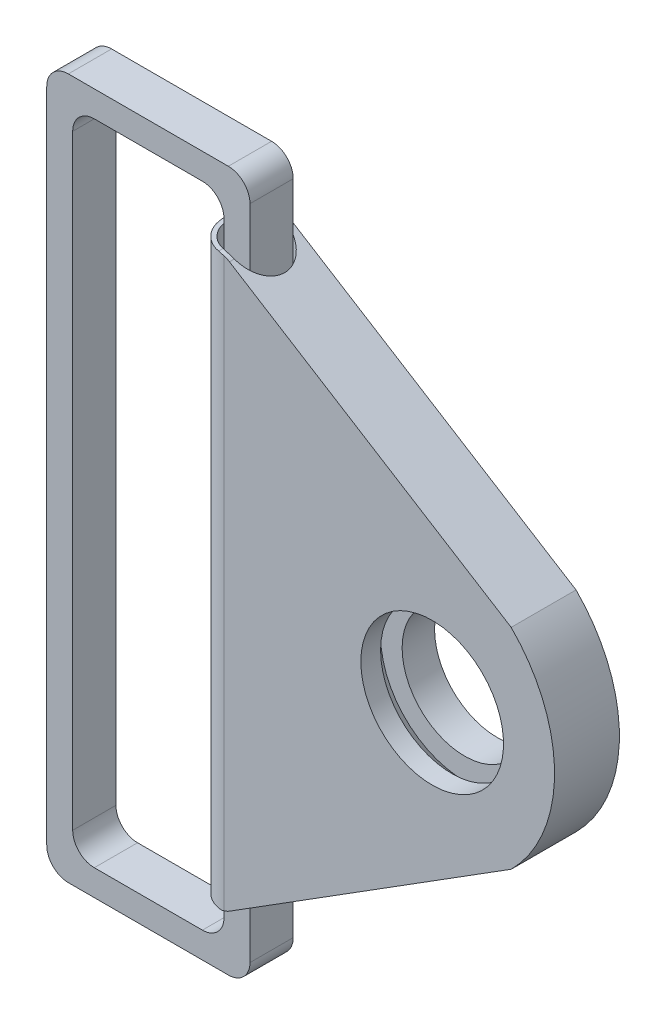
from build123d import *

# Parameters (mm, degrees)
SCHIZZO1_R                               = 2.88998006
ESTRUSIONE_ESTRUSIONE1_DEPTH             = 1.5
ESTRUSIONE_ESTRUSIONE3_REACH             = 22.293
SCHIZZO2_R                               = 1.5
ESTRUSIONE_ESTRUSIONE3_DIRECTION_2_REACH = 22.293
TAGLIO_ESTRUSIONE2_REACH                 = 22.922
SCHIZZO4_R                               = 1.297765186
TAGLIO_ESTRUSIONE2_DIRECTION_2_REACH     = 22.922
TAGLIO_ESTRUSIONE3_DEPTH                 = 21.921930902
TAGLIO_ESTRUSIONE3_DEPTH_BACK            = 21.921930902
RACCORDO3_R                              = 1
RACCORDO4_R                              = 1
SCHIZZO8_W                               = 9.4
SCHIZZO8_H                               = 32.4
SCHIZZO8_W_2                             = 7
SCHIZZO8_H_2                             = 30
ESTRUSIONE_SOTTILE1_DEPTH                = 1
RACCORDO9_R                              = 1
RACCORDO10_R                             = 1


with BuildPart() as part:
    # Schizzo1 → Estrusione-Estrusione1 (new, symmetric)
    with BuildSketch(Plane.XY):
        with BuildLine():
            Line((0, 13.049548457), (0, -13.268113525))
            Line((0, -13.268113525), (13.27389022, -4.921847321))
            ThreePointArc((13.27389022, -4.921847321), (15.281259891, -0.075628235), (13.27389022, 4.770590851))
            Line((13.27389022, 4.770590851), (0, 13.049548457))
        make_face()
        with Locations((9.620551337, -0.075628235)):
            Circle(SCHIZZO1_R, mode=Mode.SUBTRACT)
    extrude(amount=ESTRUSIONE_ESTRUSIONE1_DEPTH, both=True)

    # Estrusione-Estrusione3: up to this plane
    estrusione_estrusione3_end = Plane(origin=(0, -13.268113525, 1.5), z_dir=(-0.5322939659189773, 0.8465595867074254, 0))
    # Schizzo2 → Estrusione-Estrusione3 (add, up to the surface)
    with BuildSketch(Plane(origin=(0, 0, 0), x_dir=(1, 0, 0), z_dir=(0, 1, 0)), mode=Mode.PRIVATE) as estrusione_estrusione3_sk1:
        Circle(SCHIZZO2_R)
    estrusione_estrusione3_tool1 = split(extrude(estrusione_estrusione3_sk1.sketch, amount=-ESTRUSIONE_ESTRUSIONE3_REACH, mode=Mode.PRIVATE), bisect_by=estrusione_estrusione3_end, keep=Keep.BOTH, mode=Mode.PRIVATE)
    add(estrusione_estrusione3_tool1.solids().sort_by_distance((0, 0, 0))[0])

    # Estrusione-Estrusione3 direction 2: up to this plane
    estrusione_estrusione3_direction_2_end = Plane(origin=(0, 13.049548457, 1.5), z_dir=(-0.5292069948810272, -0.848492755755164, 0))
    # Schizzo2 → Estrusione-Estrusione3 direction 2 (add, up to the surface)
    with BuildSketch(Plane(origin=(0, 0, 0), x_dir=(1, 0, 0), z_dir=(0, 1, 0)), mode=Mode.PRIVATE) as estrusione_estrusione3_direction_2_sk1:
        Circle(SCHIZZO2_R)
    estrusione_estrusione3_direction_2_tool1 = split(extrude(estrusione_estrusione3_direction_2_sk1.sketch, amount=ESTRUSIONE_ESTRUSIONE3_DIRECTION_2_REACH, mode=Mode.PRIVATE), bisect_by=estrusione_estrusione3_direction_2_end, keep=Keep.BOTH, mode=Mode.PRIVATE)
    add(estrusione_estrusione3_direction_2_tool1.solids().sort_by_distance((0, 0, 0))[0])

    # Taglio-Estrusione2: up to this plane
    taglio_estrusione2_end = Plane(origin=(0, -13.268113525, 1.5), z_dir=(-0.5322939659189773, 0.8465595867074254, 0))
    # Schizzo4 → Taglio-Estrusione2 (cut, up to the surface)
    with BuildSketch(Plane(origin=(0, 0, 0), x_dir=(1, 0, 0), z_dir=(0, 1, 0)), mode=Mode.PRIVATE) as taglio_estrusione2_sk1:
        Circle(SCHIZZO4_R)
    taglio_estrusione2_tool1 = split(extrude(taglio_estrusione2_sk1.sketch, amount=-TAGLIO_ESTRUSIONE2_REACH, mode=Mode.PRIVATE), bisect_by=taglio_estrusione2_end, keep=Keep.BOTH, mode=Mode.PRIVATE)
    add(taglio_estrusione2_tool1.solids().sort_by_distance((0, 0, 0))[0], mode=Mode.SUBTRACT)

    # Taglio-Estrusione2 direction 2: up to this plane
    taglio_estrusione2_direction_2_end = Plane(origin=(0, 13.049548457, 1.5), z_dir=(-0.5292069948810272, -0.848492755755164, 0))
    # Schizzo4 → Taglio-Estrusione2 direction 2 (cut, up to the surface)
    with BuildSketch(Plane(origin=(0, 0, 0), x_dir=(1, 0, 0), z_dir=(0, 1, 0)), mode=Mode.PRIVATE) as taglio_estrusione2_direction_2_sk1:
        Circle(SCHIZZO4_R)
    taglio_estrusione2_direction_2_tool1 = split(extrude(taglio_estrusione2_direction_2_sk1.sketch, amount=TAGLIO_ESTRUSIONE2_DIRECTION_2_REACH, mode=Mode.PRIVATE), bisect_by=taglio_estrusione2_direction_2_end, keep=Keep.BOTH, mode=Mode.PRIVATE)
    add(taglio_estrusione2_direction_2_tool1.solids().sort_by_distance((0, 0, 0))[0], mode=Mode.SUBTRACT)

    # Schizzo5 → Taglio-Estrusione3 (cut, two sides: drawn at the far end of the back side and taken through both)
    with BuildSketch(Plane.XY.offset(-TAGLIO_ESTRUSIONE3_DEPTH_BACK)):
        Polygon((0, 13.049548457), (-1.5, 13.049548457), (-1.5, 13.985102104), align=None)
        Polygon((0, -13.268113525), (-1.5, -13.268113525), (-1.5, -14.2112733), align=None)
    extrude(amount=TAGLIO_ESTRUSIONE3_DEPTH + TAGLIO_ESTRUSIONE3_DEPTH_BACK, mode=Mode.SUBTRACT)

    # Raccordo3
    raccordo3_edges = [part.edges().sort_by_distance(p)[0] for p in [
        (0, 13.049548457, -1.398882593),
        (0, 13.049548457, 1.398882593),
    ]]
    fillet(raccordo3_edges, radius=RACCORDO3_R)

    # Raccordo4
    raccordo4_edges = [part.edges().sort_by_distance(p)[0] for p in [
        (0, -13.268113525, -1.398882593),
        (0, -13.268113525, 1.398882593),
    ]]
    fillet(raccordo4_edges, radius=RACCORDO4_R)

    # Schizzo10 → Foro filettato G1/16-1 (revolve, cut)
    with BuildSketch(Plane(origin=(9.620551337, -0.075628235, 0), x_dir=(0, 1, 0), z_dir=(1, 0, 0))):
        Polygon((0, 0), (0, 1.5), (3.3, 1.5), (3.3, 0.5865), (3.8865, 0), align=None)
    revolve(axis=Axis((9.620551337, -0.075628235, -6.35), (0, 0, 1)), mode=Mode.SUBTRACT)


with BuildPart() as body_2:
    # Schizzo8 → Estrusione-Sottile1 (new, symmetric)
    with BuildSketch(Plane.XY):
        with Locations((-4.007903113, 0)):
            Rectangle(SCHIZZO8_W, SCHIZZO8_H)
        with Locations((-4.007903113, 0)):
            Rectangle(SCHIZZO8_W_2, SCHIZZO8_H_2, mode=Mode.SUBTRACT)
    extrude(amount=ESTRUSIONE_SOTTILE1_DEPTH, both=True)

    # Raccordo9
    raccordo9_edges = [body_2.edges().sort_by_distance(p)[0] for p in [
        (0.692096887, -16.2, 0),
        (-8.707903113, -16.2, 0),
        (0.692096887, 16.2, 0),
        (-8.707903113, 16.2, 0),
    ]]
    fillet(raccordo9_edges, radius=RACCORDO9_R)

    # Raccordo10
    raccordo10_edges = [body_2.edges().sort_by_distance(p)[0] for p in [
        (-0.507903113, -15, 0),
        (-7.507903113, -15, 0),
        (-0.507903113, 15, 0),
        (-7.507903113, 15, 0),
    ]]
    fillet(raccordo10_edges, radius=RACCORDO10_R)


solid = Compound([part.part, body_2.part])
